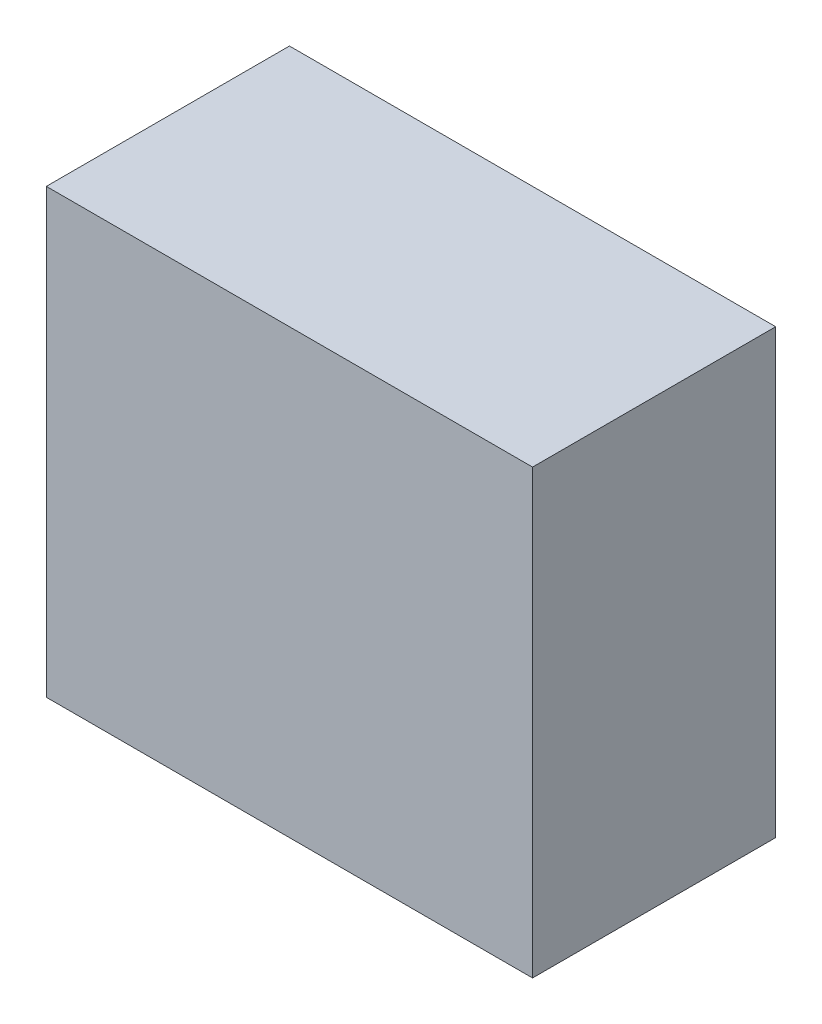
from build123d import *

# Parameters (mm, degrees)
SKETCH1_W           = 50.8
SKETCH1_H           = 25.4
BOSS_EXTRUDE1_DEPTH = 46.23


with BuildPart() as part:
    # Sketch1 → Boss-Extrude1 (new body)
    with BuildSketch(Plane(origin=(0, 0, 0), x_dir=(1, 0, 0), z_dir=(0, 1, 0))):
        Rectangle(SKETCH1_W, SKETCH1_H)
    extrude(amount=BOSS_EXTRUDE1_DEPTH)


solid = part.part
